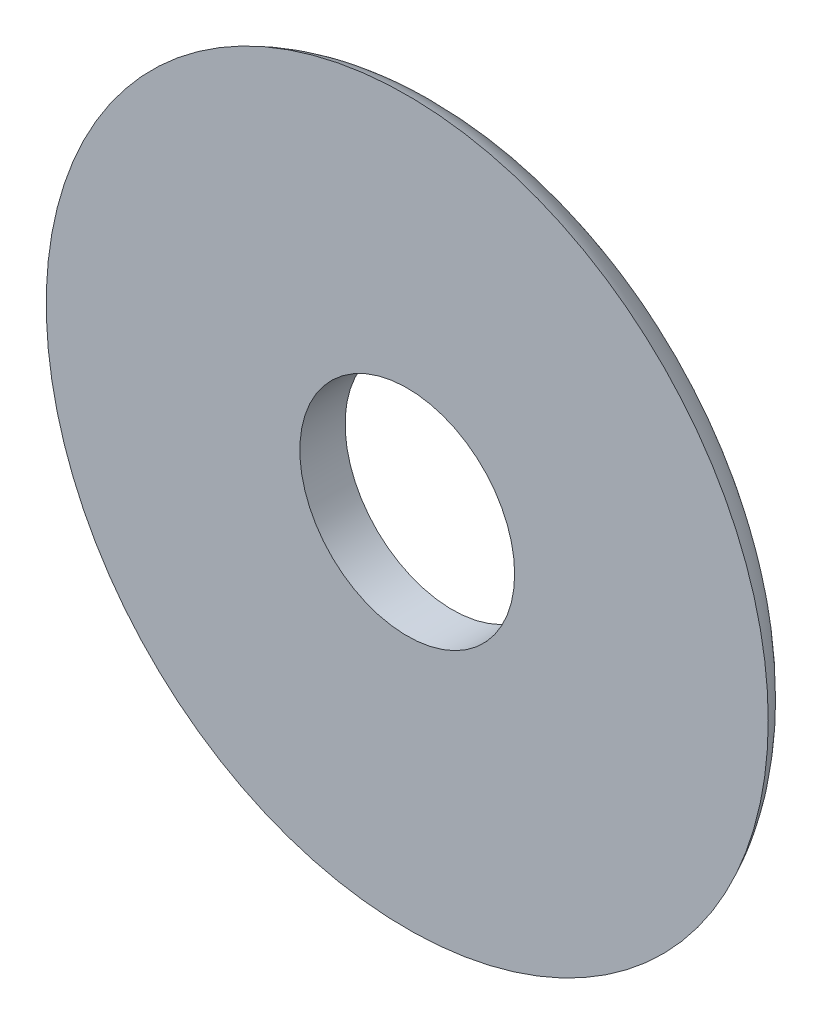
from build123d import *

# Parameters (mm, degrees)
SKETCH1_R           = 47.85
BOSS_EXTRUDE1_DEPTH = 6
SKETCH2_R           = 14.235
CUT_EXTRUDE1_DEPTH  = 6
FILLET2_R           = 10


with BuildPart() as part:
    # Sketch1 → Boss-Extrude1 (new body)
    with BuildSketch(Plane.XY):
        Circle(SKETCH1_R)
    extrude(amount=BOSS_EXTRUDE1_DEPTH)

    # Sketch2 → Cut-Extrude1 (cut)
    with BuildSketch(Plane.XY.offset(6)):
        Circle(SKETCH2_R)
    extrude(amount=-CUT_EXTRUDE1_DEPTH, mode=Mode.SUBTRACT)

    # Fillet2
    # the kernel refuses this fillet: 10 mm, written as the material it takes off along each edge
    with BuildSketch(Plane(origin=(0, 0, 0), x_dir=(1, 0, 0), z_dir=(0, -1, 0))) as fillet2_piece_1:
        with BuildLine():
            CenterArc((38.68484861, 10), FILLET2_R, 270, 66.421821522)
            Line((38.68484861, 0), (38.68484861, -0.2))
            Line((38.68484861, -0.2), (47.85, -0.2))
            Line((47.85, -0.2), (48.05, 0))
            ThreePointArc((48.05, 0), (48.05, 3), (48.033303028, 5.92))
            Line((48.033303028, 5.92), (47.85, 6))
        make_face()
    revolve(axis=Axis((0, 0, 0), (0, 0, 1)), mode=Mode.SUBTRACT)


solid = part.part
